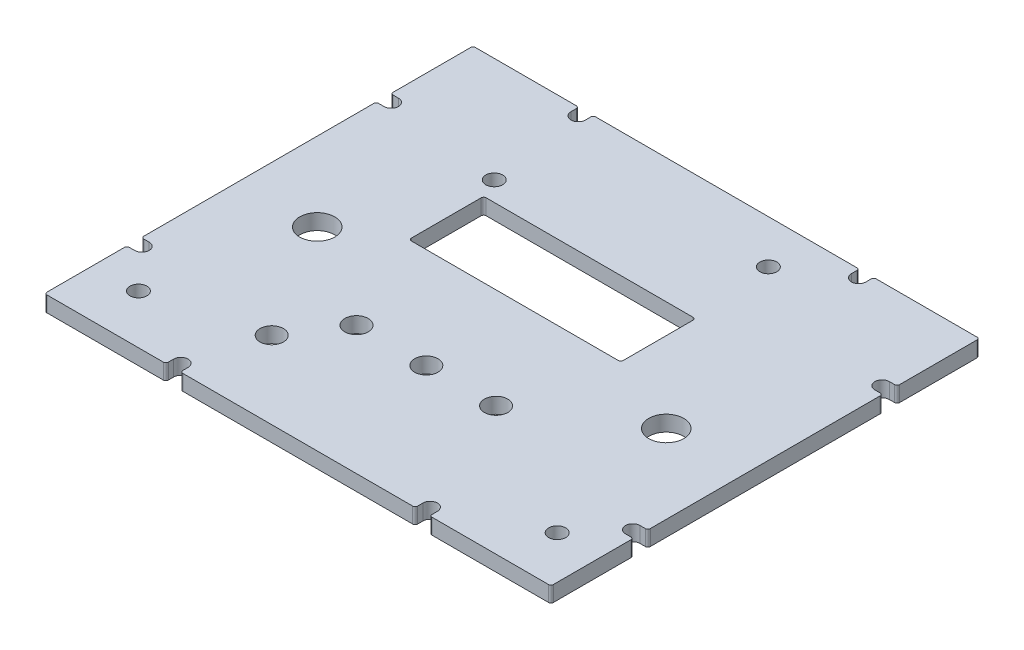
from build123d import *

# Parameters (mm, degrees)
SKETCH1_W                       = 103.1875
SKETCH1_H                       = 87.3125
BOSS_EXTRUDE1_DEPTH             = 3.175
F_29_0_136_DIAMETER_HOLE1_D     = 3.4544
F_9_32_0_28125_DIAMETER_HOLE1_D = 7.14375
F_3_16_0_1875_DIAMETER_HOLE1_D  = 4.7625
SKETCH8_W                       = 43.18
SKETCH8_H                       = 15.24
CUT_EXTRUDE1_DEPTH              = 68.659913007
CUT_EXTRUDE2_DEPTH              = 68.659913007
FILLET1_R                       = 0.508
CUT_EXTRUDE3_DEPTH              = 68.659913007
FILLET2_R                       = 0.508


with BuildPart() as part:
    # Sketch1 → Boss-Extrude1 (new body)
    with BuildSketch(Plane(origin=(0, 0, 0), x_dir=(1, 0, 0), z_dir=(0, 1, 0))):
        Rectangle(SKETCH1_W, SKETCH1_H)
    extrude(amount=BOSS_EXTRUDE1_DEPTH)

    # #29 (0.136) Diameter Hole1 (through all)
    with Locations(Plane(origin=(0, 3.175, 0), x_dir=(1, 0, 0), z_dir=(0, 1, 0))):
        with Locations((-25.8318, 22.2123), (17.4498, 34.7853), (42.8498, -33.6423), (-42.4688, -33.6423)):
            Hole(F_29_0_136_DIAMETER_HOLE1_D / 2)

    # 9/32 (0.28125) Diameter Hole1 (through all)
    with Locations(Plane(origin=(0, 3.175, 0), x_dir=(1, 0, 0), z_dir=(0, 1, 0))):
        with Locations((-35.56, -4.1275), (35.56, -4.1275)):
            Hole(F_9_32_0_28125_DIAMETER_HOLE1_D / 2)

    # 3/16 (0.1875) Diameter Hole1 (through all)
    with Locations(Plane(origin=(0, 3.175, 0), x_dir=(1, 0, 0), z_dir=(0, 1, 0))):
        with Locations((-14.224, -17.4625), (0, -17.4625), (14.224, -17.4625), (-21.082, -27.8765)):
            Hole(F_3_16_0_1875_DIAMETER_HOLE1_D / 2)

    # Sketch8 → Cut-Extrude1 (cut, through all)
    with BuildSketch(Plane(origin=(0, 3.175, 0), x_dir=(1, 0, 0), z_dir=(0, 1, 0))):
        with Locations((-2.413, 10.6045)):
            Rectangle(SKETCH8_W, SKETCH8_H)
    extrude(amount=-CUT_EXTRUDE1_DEPTH, mode=Mode.SUBTRACT)

    # Sketch9 → Cut-Extrude2 (cut, through all)
    with BuildSketch(Plane(origin=(0, 3.175, 0), x_dir=(1, 0, 0), z_dir=(0, 1, 0))):
        with BuildLine():
            Line((-50.00625, 26.8732), (-51.59375, 26.8732))
            Line((-51.59375, 26.8732), (-51.59375, 23.9268))
            Line((-51.59375, 23.9268), (-50.00625, 23.9268))
            ThreePointArc((-50.00625, 23.9268), (-48.53305, 25.4), (-50.00625, 26.8732))
        make_face()
        with BuildLine():
            Line((-50.00625, -23.9268), (-51.59375, -23.9268))
            Line((-51.59375, -23.9268), (-51.59375, -26.8732))
            Line((-51.59375, -26.8732), (-50.00625, -26.8732))
            ThreePointArc((-50.00625, -26.8732), (-48.53305, -25.4), (-50.00625, -23.9268))
        make_face()
        with BuildLine():
            Line((50.00625, -26.8732), (51.59375, -26.8732))
            Line((51.59375, -26.8732), (51.59375, -23.9268))
            Line((51.59375, -23.9268), (50.00625, -23.9268))
            ThreePointArc((50.00625, -23.9268), (48.53305, -25.4), (50.00625, -26.8732))
        make_face()
        with BuildLine():
            Line((51.59375, 26.8732), (51.59375, 23.9268))
            Line((51.59375, 23.9268), (50.00625, 23.9268))
            ThreePointArc((50.00625, 23.9268), (48.53305, 25.4), (50.00625, 26.8732))
            Line((50.00625, 26.8732), (51.59375, 26.8732))
        make_face()
    extrude(amount=-CUT_EXTRUDE2_DEPTH, mode=Mode.SUBTRACT)

    # Fillet1
    fillet1_edges = [part.edges().sort_by_distance(p)[0] for p in [
        (51.59375, 1.5875, -23.9268),
        (51.59375, 1.5875, -26.8732),
        (51.59375, 1.5875, 23.9268),
        (51.59375, 1.5875, 26.8732),
        (-51.59375, 1.5875, 23.9268),
        (-51.59375, 1.5875, 26.8732),
        (-51.59375, 1.5875, -23.9268),
        (-51.59375, 1.5875, -26.8732),
        (-24.003, 1.5875, -2.9845),
        (19.177, 1.5875, -2.9845),
        (19.177, 1.5875, -18.2245),
        (-24.003, 1.5875, -18.2245),
    ]]
    fillet(fillet1_edges, radius=FILLET1_R)

    # Sketch10 → Cut-Extrude3 (cut, through all)
    with BuildSketch(Plane(origin=(0, 3.175, 0), x_dir=(1, 0, 0), z_dir=(0, 1, 0))):
        with BuildLine():
            Line((-27.1018, 42.06875), (-27.1018, 43.65625))
            Line((-27.1018, 43.65625), (-30.0482, 43.65625))
            Line((-30.0482, 43.65625), (-30.0482, 42.06875))
            ThreePointArc((-30.0482, 42.06875), (-28.575, 40.59555), (-27.1018, 42.06875))
        make_face()
        with BuildLine():
            Line((26.8732, -42.06875), (26.8732, -43.65625))
            Line((26.8732, -43.65625), (23.9268, -43.65625))
            Line((23.9268, -43.65625), (23.9268, -42.06875))
            ThreePointArc((23.9268, -42.06875), (25.4, -40.59555), (26.8732, -42.06875))
        make_face()
        with BuildLine():
            Line((-23.9268, -42.06875), (-23.9268, -43.65625))
            Line((-23.9268, -43.65625), (-26.8732, -43.65625))
            Line((-26.8732, -43.65625), (-26.8732, -42.06875))
            ThreePointArc((-26.8732, -42.06875), (-25.4, -40.59555), (-23.9268, -42.06875))
        make_face()
        with BuildLine():
            Line((30.0482, 43.65625), (27.1018, 43.65625))
            Line((27.1018, 43.65625), (27.1018, 42.06875))
            ThreePointArc((27.1018, 42.06875), (28.575, 40.59555), (30.0482, 42.06875))
            Line((30.0482, 42.06875), (30.0482, 43.65625))
        make_face()
    extrude(amount=-CUT_EXTRUDE3_DEPTH, mode=Mode.SUBTRACT)

    # Fillet2
    fillet2_edges = [part.edges().sort_by_distance(p)[0] for p in [
        (30.0482, 1.5875, -43.65625),
        (27.1018, 1.5875, -43.65625),
        (-30.0482, 1.5875, -43.65625),
        (-27.1018, 1.5875, -43.65625),
        (-23.9268, 1.5875, 43.65625),
        (-26.8732, 1.5875, 43.65625),
        (23.9268, 1.5875, 43.65625),
        (26.8732, 1.5875, 43.65625),
        (51.59375, 1.5875, 43.65625),
        (51.59375, 1.5875, -43.65625),
        (-51.59375, 1.5875, -43.65625),
        (-51.59375, 1.5875, 43.65625),
    ]]
    fillet(fillet2_edges, radius=FILLET2_R)


solid = part.part
